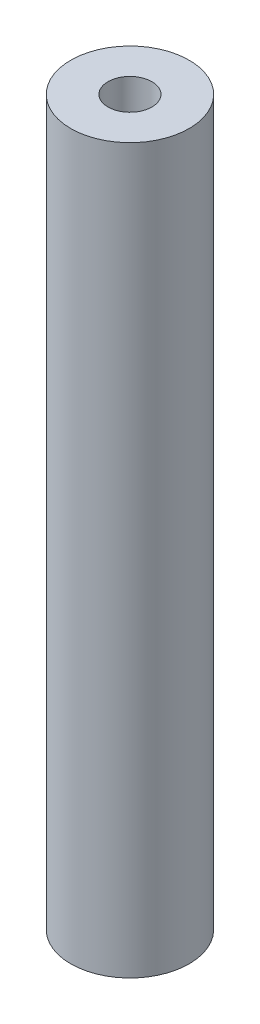
from build123d import *

# Parameters (mm, degrees)
SKETCH1_R           = 5.715
SKETCH1_R_2         = 2.1209
BOSS_EXTRUDE1_DEPTH = 69.8246


with BuildPart() as part:
    # Sketch1 → Boss-Extrude1 (new body)
    with BuildSketch(Plane(origin=(0, 0, 0), x_dir=(1, 0, 0), z_dir=(0, 1, 0))):
        Circle(SKETCH1_R)
        Circle(SKETCH1_R_2, mode=Mode.SUBTRACT)
    extrude(amount=BOSS_EXTRUDE1_DEPTH)


solid = part.part
